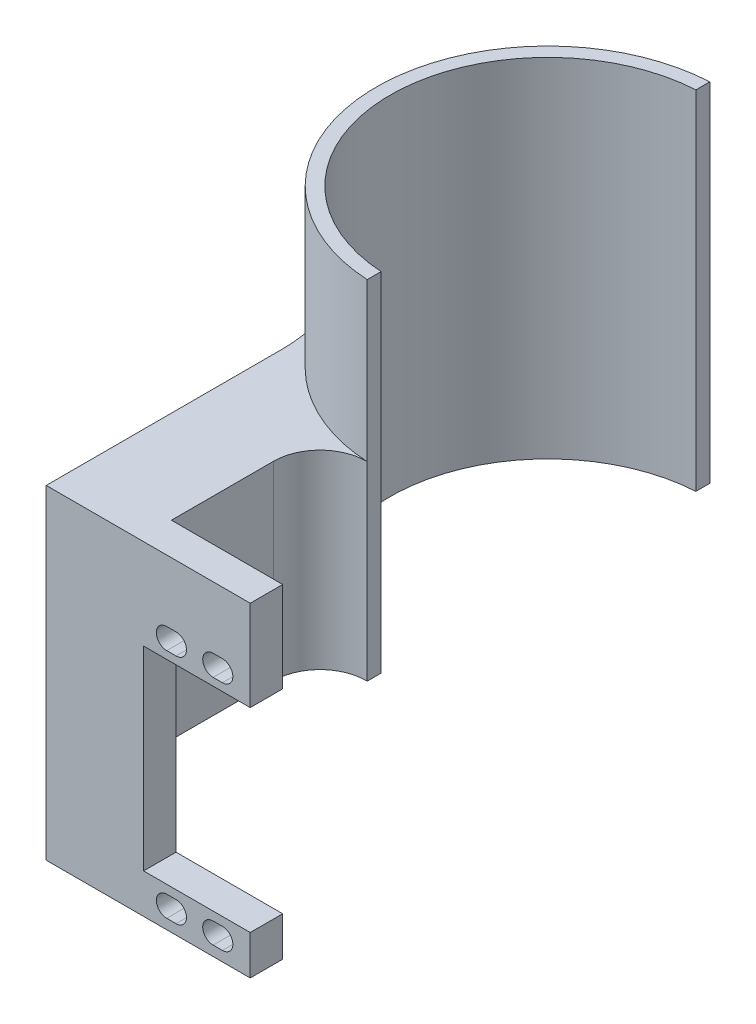
from build123d import *

# Parameters (mm, degrees)
BOSS_EXTRU_1_DEPTH      = 75
BOSS_EXTRU_2_START      = -70
BOSS_EXTRU_2_DEPTH      = 70
ENL_V_START             = -29
ENL_V_MAT_EXTRU_1_DEPTH = 29
CONG_1_R                = 30
CONG_2_R                = 10
ESQUISSE5_W             = 23
ESQUISSE5_H             = 42
ENL_V_MAT_EXTRU_2_DEPTH = 146.632261285


with BuildPart() as part:
    # Esquisse1 → Boss.-Extru.1 (new body)
    with BuildSketch(Plane(origin=(0, 11.1, 0), x_dir=(0, 0, 1), z_dir=(0, -1, 0))):
        with BuildLine():
            Line((-50.360184389, 1.826437931), (-53.360184389, 1.826437931))
            ThreePointArc((-53.360184389, 1.826437931), (-16.419058892, 36.821664014), (20.522066605, 1.826437931))
            Line((20.522066605, 1.826437931), (17.522066605, 1.826437931))
            ThreePointArc((17.522066605, 1.826437931), (-16.419058892, 33.826437931), (-50.360184389, 1.826437931))
        make_face()
    extrude(amount=BOSS_EXTRU_1_DEPTH)

    # Esquisse3 → Boss.-Extru.2 (add)
    with BuildSketch(Plane(origin=(0, -92.9, 0), x_dir=(-1, 0, 0), z_dir=(0, -1, 0)).offset(BOSS_EXTRU_2_START)):
        with BuildLine():
            Line((32, -1.84316049), (32, -59.576167192))
            Line((32, -59.576167192), (-12, -59.576167192))
            Line((-12, -59.576167192), (-12, -52.576167192))
            Line((-12, -52.576167192), (12, -52.576167192))
            Line((12, -52.576167192), (12, -18.515896948))
            ThreePointArc((12, -18.515896948), (23.515293751, -11.997219241), (32, -1.84316049))
        make_face()
    extrude(amount=BOSS_EXTRU_2_DEPTH)

    # Esquisse4 → Enlèv. mat.-Extru.1 (cut)
    with BuildSketch(Plane.XZ.offset(92.9).offset(ENL_V_START)):
        with BuildLine():
            Line((-12, 18.515896948), (-12, 52.576167192))
            Line((-12, 52.576167192), (-32, 52.576167192))
            Line((-32, 52.576167192), (-32, 1.84316049))
            ThreePointArc((-32, 1.84316049), (-23.515293751, 11.997219241), (-12, 18.515896948))
        make_face()
    extrude(amount=ENL_V_MAT_EXTRU_1_DEPTH, mode=Mode.SUBTRACT)

    # Congé1
    cong_1_edges = [part.edges().sort_by_distance(p)[0] for p in [
        (-32, -43.4, 1.84316049),
    ]]
    fillet(cong_1_edges, radius=CONG_1_R)

    # Congé2
    # the kernel refuses this fillet: 10 mm, written as the material it adds along each edge
    with BuildSketch(Plane(origin=(-12, -22.9, 18.515896948), x_dir=(0, 0, 1), z_dir=(0, -1, 0))) as cong_2_piece_1_section:
        with BuildLine():
            CenterArc((12.004663354, -10), CONG_2_R, 90, 90.994487339)
            Line((2.006169657, -10.173562069), (1.806199783, -10.177033311))
            ThreePointArc((1.806199783, -10.177033311), (1.165077614, -5.054836961), (-0.188861967, -0.06581153))
            Line((-0.188861967, -0.06581153), (0, 0.2))
            Line((0, 0.2), (12.004663354, 0.2))
            Line((12.004663354, 0.2), (12.004663354, 0))
        make_face()
    cong_2_piece_1 = extrude(amount=41, mode=Mode.PRIVATE)
    cong_2_piece_1 = split(cong_2_piece_1, bisect_by=Plane(origin=(-1.826437931, -43.4, 22.039675227), z_dir=(-1, 0, 0)), keep=Keep.TOP, mode=Mode.PRIVATE)
    add(cong_2_piece_1)

    # Esquisse5 → Enlèv. mat.-Extru.2 (cut, through all)
    with BuildSketch(Plane(origin=(0, 0, 52.576167192), x_dir=(-1, 0, 0), z_dir=(0, 0, -1))):
        with Locations((-0.5, -63.4)):
            Rectangle(ESQUISSE5_W, ESQUISSE5_H)
        with BuildLine():
            Line((-6, -36.25), (-4, -36.25))
            ThreePointArc((-4, -36.25), (-1.75, -38.5), (-4, -40.75))
            Line((-4, -40.75), (-6, -40.75))
            ThreePointArc((-6, -40.75), (-8.25, -38.5), (-6, -36.25))
        make_face()
        with BuildLine():
            Line((4, -36.25), (6, -36.25))
            ThreePointArc((6, -36.25), (8.25, -38.5), (6, -40.75))
            Line((6, -40.75), (4, -40.75))
            ThreePointArc((4, -40.75), (1.75, -38.5), (4, -36.25))
        make_face()
        with BuildLine():
            Line((-6, -86.25), (-4, -86.25))
            ThreePointArc((-4, -86.25), (-1.75, -88.5), (-4, -90.75))
            Line((-4, -90.75), (-6, -90.75))
            ThreePointArc((-6, -90.75), (-8.25, -88.5), (-6, -86.25))
        make_face()
        with BuildLine():
            Line((4, -86.25), (6, -86.25))
            ThreePointArc((6, -86.25), (8.25, -88.5), (6, -90.75))
            Line((6, -90.75), (4, -90.75))
            ThreePointArc((4, -90.75), (1.75, -88.5), (4, -86.25))
        make_face()
    extrude(amount=-ENL_V_MAT_EXTRU_2_DEPTH, mode=Mode.SUBTRACT)


solid = part.part
